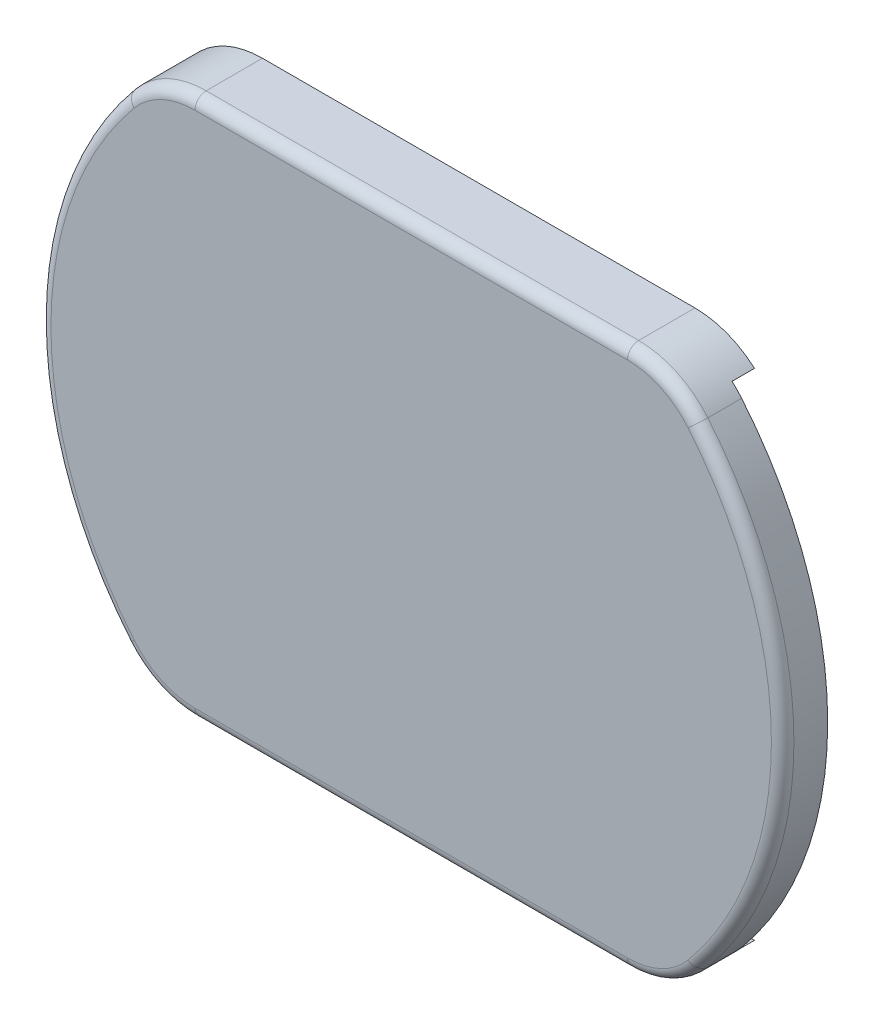
from build123d import *

# Parameters (mm, degrees)
EXTRUDE1_DEPTH     = 3
FILLET2_R          = 0.5
CAVITY1_DEPTH      = 1
CAVITY1_START      = 0.75
CAVITY1_2_DEPTH    = 0.25
CUT_EXTRUDE1_START = -1
CUT_EXTRUDE1_DEPTH = 1


# Read off the part's stored shape, not the designer's step: Cavity1
with BuildPart() as part:
    # Sketch1 → Extrude1 (new body)
    with BuildSketch(Plane.XY):
        with BuildLine():
            Line((-9.604686356, -12), (9.604686356, -12))
            ThreePointArc((9.604686356, -12), (11.301742631, -11.622154055), (12.67818599, -10.56))
            ThreePointArc((12.67818599, -10.56), (16.5, 0), (12.67818599, 10.56))
            ThreePointArc((12.67818599, 10.56), (11.301742631, 11.622154055), (9.604686356, 12))
            Line((9.604686356, 12), (-9.604686356, 12))
            ThreePointArc((-9.604686356, 12), (-11.301742631, 11.622154055), (-12.67818599, 10.56))
            ThreePointArc((-12.67818599, 10.56), (-16.5, 0), (-12.67818599, -10.56))
            ThreePointArc((-12.67818599, -10.56), (-11.301742631, -11.622154055), (-9.604686356, -12))
        make_face()
    extrude(amount=EXTRUDE1_DEPTH)

    # Fillet2
    fillet2_edges = [part.edges().sort_by_distance(p)[0] for p in [
        (11.301742631, -11.622154055, 3),
        (16.5, 0, 3),
        (11.301742631, 11.622154055, 3),
        (0, 12, 3),
        (-11.301742631, 11.622154055, 3),
        (-16.5, 0, 3),
        (-11.301742631, -11.622154055, 3),
        (0, -12, 3),
    ]]
    fillet(fillet2_edges, radius=FILLET2_R)

    # Cavity1 outline → Cavity1 (cut)
    with BuildSketch(Plane.XY):
        with BuildLine():
            ThreePointArc((-9.366025404, 10.5), (-9.465925826, 10.258819045), (-9.5, 10))
            Line((-9.5, 10), (-8.996077446, 10))
            Line((-8.996077446, 10), (-8.996077446, 8.00000585))
            Line((-8.996077446, 8.00000585), (-7.996077446, 8.00000585))
            Line((-7.996077446, 8.00000585), (-7.996077446, 10))
            Line((-7.996077446, 10), (-0.5, 10))
            Line((-0.5, 10), (-0.5, 7.000002926))
            Line((-0.5, 7.000002926), (0.5, 7.000002926))
            Line((0.5, 7.000002926), (0.5, 10))
            Line((0.5, 10), (7.996077446, 10))
            Line((7.996077446, 10), (7.996077446, 8.00000585))
            Line((7.996077446, 8.00000585), (8.996077446, 8.00000585))
            Line((8.996077446, 8.00000585), (8.996077446, 10))
            Line((8.996077446, 10), (10.062305899, 10))
            ThreePointArc((10.062305899, 10), (10.470554189, 9.912870929), (10.807661891, 9.666666667))
            ThreePointArc((10.807661891, 9.666666667), (14.5, 0), (10.807661891, -9.666666667))
            ThreePointArc((10.807661891, -9.666666667), (10.470554189, -9.912870929), (10.062305899, -10))
            Line((10.062305899, -10), (-9.5, -10))
            ThreePointArc((-9.5, -10), (-9.465925826, -10.258819045), (-9.366025404, -10.5))
            Line((-9.366025404, -10.5), (10.5, -10.5))
            Line((10.5, -10.5), (10.5, -11))
            Line((10.5, -11), (12.250437667, -11))
            ThreePointArc((12.250437667, -11), (12.47276199, -10.788214869), (12.67818599, -10.56))
            ThreePointArc((12.67818599, -10.56), (16.5, 0), (12.67818599, 10.56))
            ThreePointArc((12.67818599, 10.56), (12.47276199, 10.788214869), (12.250437667, 11))
            Line((12.250437667, 11), (10.5, 11))
            Line((10.5, 11), (10.5, 10.5))
            Line((10.5, 10.5), (-9.366025404, 10.5))
        make_face()
    extrude(amount=CAVITY1_DEPTH, mode=Mode.SUBTRACT)

    # Cavity1 2 outline → Cavity1 2 (cut)
    with BuildSketch(Plane.XY.offset(CAVITY1_START)):
        with BuildLine():
            ThreePointArc((-8.5, 11), (-9, 10.866025404), (-9.366025404, 10.5))
            Line((-9.366025404, 10.5), (10.5, 10.5))
            Line((10.5, 10.5), (10.5, 11))
            Line((10.5, 11), (-8.5, 11))
        make_face()
        with BuildLine():
            Line((-8.5, -11), (10.5, -11))
            Line((10.5, -11), (10.5, -10.5))
            Line((10.5, -10.5), (-9.366025404, -10.5))
            ThreePointArc((-9.366025404, -10.5), (-9, -10.866025404), (-8.5, -11))
        make_face()
    extrude(amount=CAVITY1_2_DEPTH, mode=Mode.SUBTRACT)

    # Sketch2 → Cut-Extrude1 (cut)
    with BuildSketch(Plane(origin=(0, 0, 0), x_dir=(-1, 0, 0), z_dir=(0, 0, -1)).offset(CUT_EXTRUDE1_START)):
        with BuildLine():
            Line((9.604686356, 10.5), (-12.727922061, 10.5))
            ThreePointArc((-12.727922061, 10.5), (-16.5, 0), (-12.727922061, -10.5))
            Line((-12.727922061, -10.5), (9.604686356, -10.5))
            ThreePointArc((9.604686356, -10.5), (10.665346528, -10.263846285), (11.525623627, -9.6))
            ThreePointArc((11.525623627, -9.6), (15, 0), (11.525623627, 9.6))
            ThreePointArc((11.525623627, 9.6), (10.665346528, 10.263846285), (9.604686356, 10.5))
        make_face()
    extrude(amount=CUT_EXTRUDE1_DEPTH, mode=Mode.SUBTRACT)


solid = part.part
